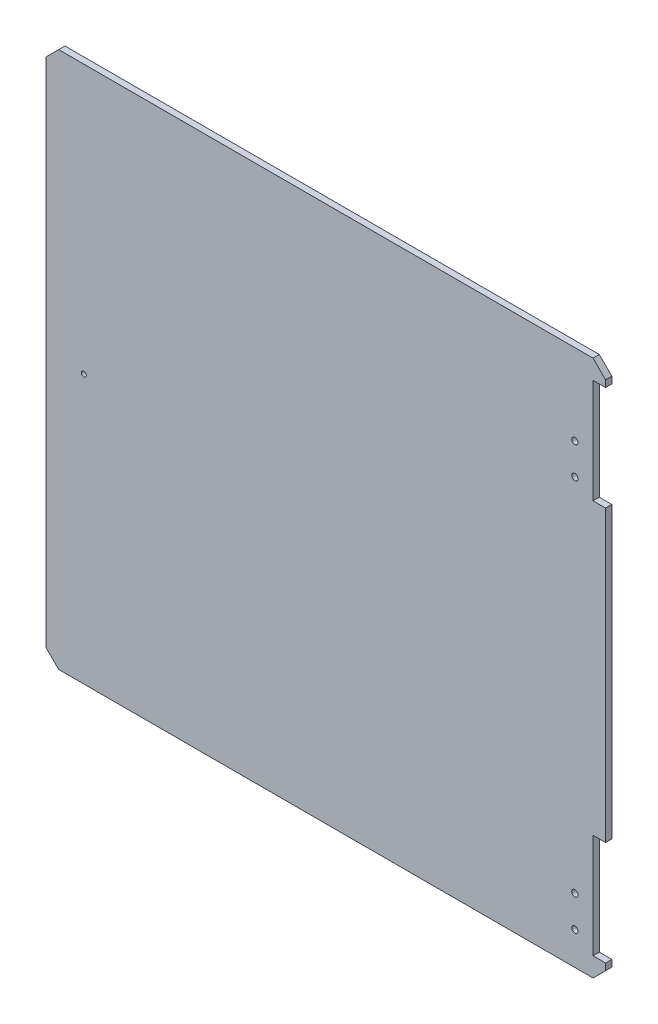
from build123d import *

# Parameters (mm, degrees)
SCHIZZO1_R                   = 2.5
SCHIZZO1_R_2                 = 2.499072061
SCHIZZO1_R_3                 = 2
ESTRUSIONE_ESTRUSIONE1_DEPTH = 5


with BuildPart() as part:
    # Schizzo1 → Estrusione-Estrusione1 (new body)
    with BuildSketch(Plane.XY):
        Polygon((-223, 204), (-213, 214), (213, 214), (223, 204), (223, 198.658355402), (213, 198.658355402), (213, 115.470714491), (223, 115.470714491), (223, -115.470714491), (213, -115.470714491), (213, -198.658355402), (223, -198.658355402), (223, -204), (213, -214), (-213, -214), (-223, -204), align=None)
        with Locations((198.51797805, 149.65244957)):
            Circle(SCHIZZO1_R, mode=Mode.SUBTRACT)
        with Locations((198.51797805, 124.65244957)):
            Circle(SCHIZZO1_R, mode=Mode.SUBTRACT)
        with Locations((198.494140307, -162.747561795)):
            Circle(SCHIZZO1_R_2, mode=Mode.SUBTRACT)
        with Locations((198.51797805, -187.74755043)):
            Circle(SCHIZZO1_R_2, mode=Mode.SUBTRACT)
        with Locations((-193, 0)):
            Circle(SCHIZZO1_R_3, mode=Mode.SUBTRACT)
    extrude(amount=ESTRUSIONE_ESTRUSIONE1_DEPTH)


solid = part.part
